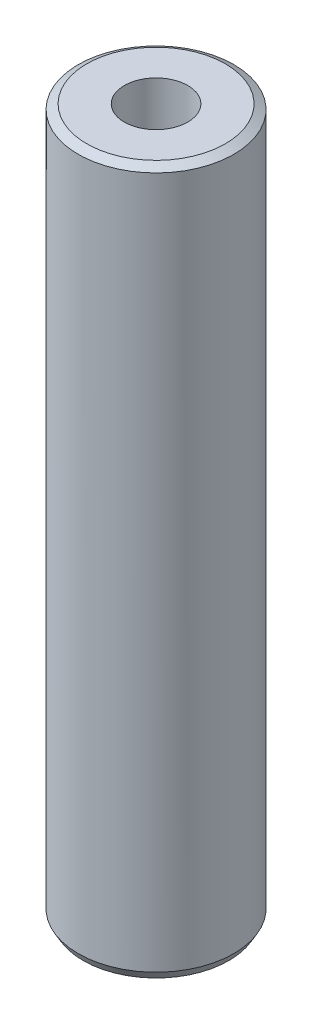
from build123d import *
from OCP.BRepFilletAPI import BRepFilletAPI_MakeChamfer

# Parameters (mm, degrees)
SKETCH1_R           = 30
BOSS_EXTRUDE1_DEPTH = 272.101556014
SKETCH2_R           = 12.234061382
CUT_EXTRUDE1_DEPTH  = 276.389282263
CHAMFER1_SIZE       = 1.889866846
CHAMFER1_SIZE2      = 3.273345397


with BuildPart() as part:
    # Sketch1 → Boss-Extrude1 (new body)
    with BuildSketch(Plane(origin=(0, 0, 0), x_dir=(1, 0, 0), z_dir=(0, 1, 0))):
        Circle(SKETCH1_R)
    extrude(amount=BOSS_EXTRUDE1_DEPTH)

    # Sketch2 → Cut-Extrude1 (cut, through all)
    with BuildSketch(Plane(origin=(0, 0, 0), x_dir=(1, 0, 0), z_dir=(0, 1, 0))):
        Circle(SKETCH2_R)
    extrude(amount=CUT_EXTRUDE1_DEPTH, mode=Mode.SUBTRACT)

    # Chamfer1: one chamfer whose edges measure the first distance from different faces: ONE call of the kernel's chamfer builder (chamfer() names one face for all edges)
    chamfer1_edges_1 = [part.edges().sort_by_distance(p)[0] for p in [
        (-30, 272.101556014, 0),
    ]]
    chamfer1_side_1 = [part.faces().sort_by_distance(p)[0] for p in [
        (-30, 136.050778007, 0),
    ]]
    chamfer1_edges_2 = [part.edges().sort_by_distance(p)[0] for p in [
        (-30, 0, 0),
    ]]
    chamfer1_side_2 = [part.faces().sort_by_distance(p)[0] for p in [
        (-29.151471863, 0, 0),
    ]]
    chamfer1 = BRepFilletAPI_MakeChamfer(part.part.solid().wrapped)
    for e in chamfer1_edges_1:
        chamfer1.Add(CHAMFER1_SIZE, CHAMFER1_SIZE2, e.wrapped, chamfer1_side_1[0].wrapped)  # the first distance lies on this face
    for e in chamfer1_edges_2:
        chamfer1.Add(CHAMFER1_SIZE, CHAMFER1_SIZE2, e.wrapped, chamfer1_side_2[0].wrapped)  # the first distance lies on this face
    add(Compound.cast(chamfer1.Shape()), mode=Mode.REPLACE)


solid = part.part
